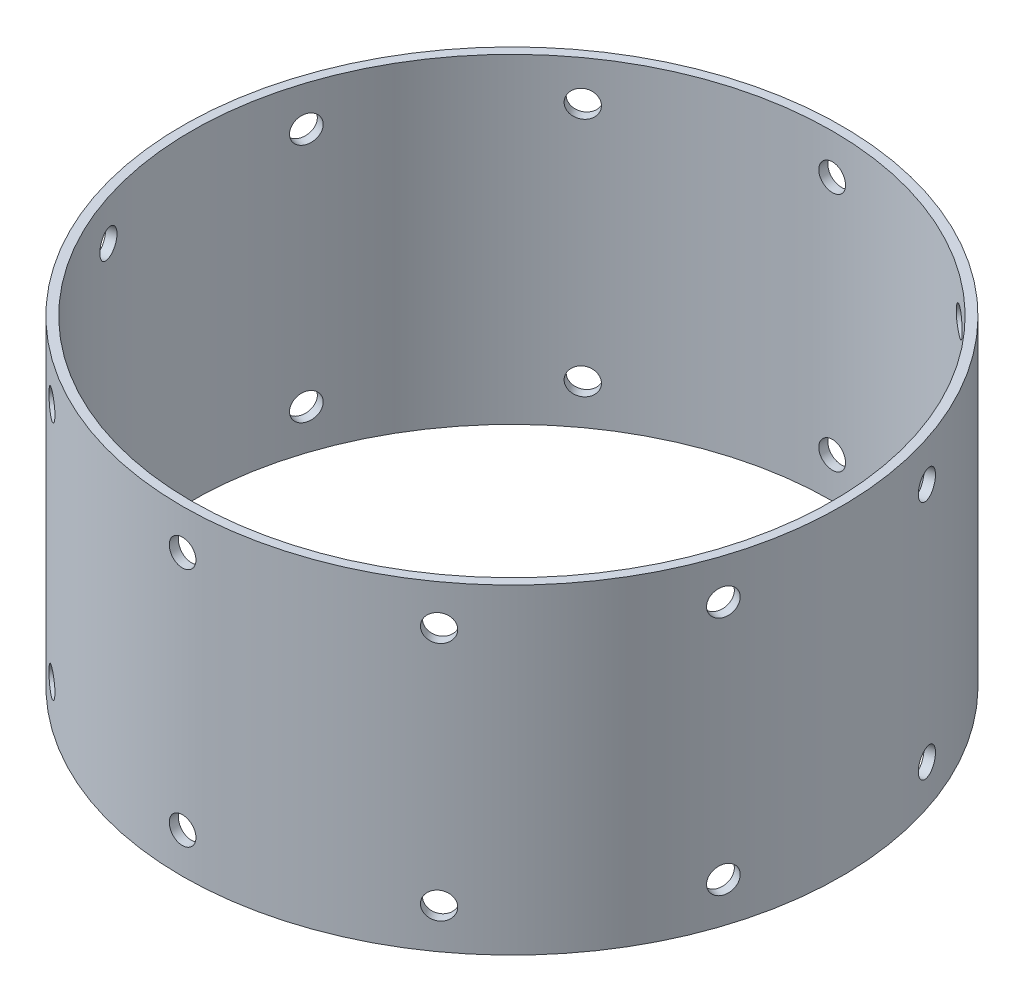
from build123d import *

# Parameters (mm, degrees)
SKETCH1_R           = 78.359
SKETCH1_R_2         = 76.2
BOSS_EXTRUDE1_DEPTH = 76.2
SKETCH2_R           = 3.175
CUT_EXTRUDE1_DEPTH  = 135.486823749
CIRPATTERN1_COUNT   = 10


with BuildPart() as part:
    # Sketch1 → Boss-Extrude1 (new body)
    with BuildSketch(Plane(origin=(0, 0, 0), x_dir=(1, 0, 0), z_dir=(0, 1, 0))):
        Circle(SKETCH1_R)
        Circle(SKETCH1_R_2, mode=Mode.SUBTRACT)
    extrude(amount=BOSS_EXTRUDE1_DEPTH)

    # Sketch2 → Cut-Extrude1 (cut, through all)
    with BuildSketch(Plane.XY):
        with Locations((0, 9.525)):
            Circle(SKETCH2_R)
        with Locations((0, 66.675)):
            Circle(SKETCH2_R)
    cut_extrude1 = extrude(amount=-CUT_EXTRUDE1_DEPTH, mode=Mode.SUBTRACT)

    # CirPattern1: Cut-Extrude1 ×10 about axis
    cirpattern1_axis = Axis((0, 0, 0), (0, 1, 0))
    for i in range(1, CIRPATTERN1_COUNT):
        add(cut_extrude1.rotate(cirpattern1_axis, i * 360 / CIRPATTERN1_COUNT), mode=Mode.SUBTRACT)


solid = part.part
